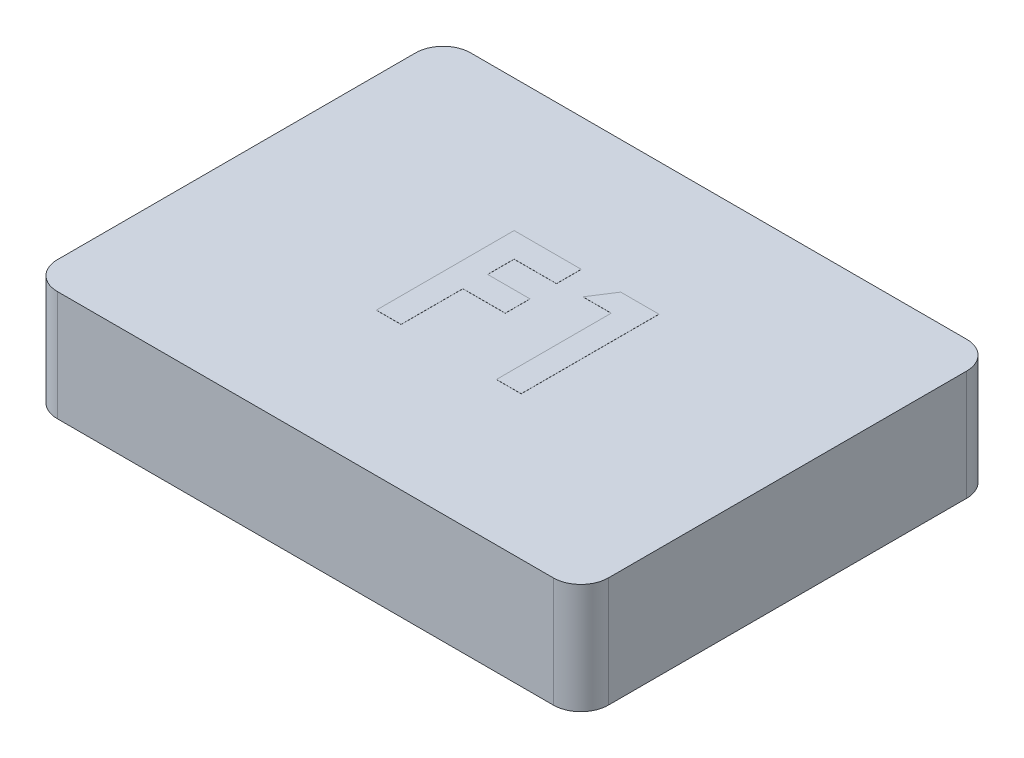
from build123d import *

# Parameters (mm, degrees)
SKETCH1_W           = 12.7
SKETCH1_H           = 9.525
BOSS_EXTRUDE1_DEPTH = 2.54
FILLET1_R           = 0.635
SHELL1_START        = 0.635
SHELL1_OUTLINE_W    = 1.905
SHELL1_OUTLINE_H    = 8.255
SHELL1_DEPTH        = 11.43
SKETCH2_R           = 2.54
BOSS_EXTRUDE2_DEPTH = 1.905
BOSS_EXTRUDE3_DEPTH = 0.00254


# Read off the part's stored shape, not the designer's step: Shell1
with BuildPart() as part:
    # Sketch1 → Boss-Extrude1 (new body)
    with BuildSketch(Plane(origin=(0, 0, 0), x_dir=(1, 0, 0), z_dir=(0, 1, 0))):
        with Locations((6.35, 4.7625)):
            Rectangle(SKETCH1_W, SKETCH1_H)
    extrude(amount=BOSS_EXTRUDE1_DEPTH)

    # Fillet1
    fillet1_edges = [part.edges().sort_by_distance(p)[0] for p in [
        (0, 1.27, -9.525),
        (12.7, 1.27, -9.525),
        (12.7, 1.27, 0),
        (0, 1.27, 0),
    ]]
    fillet(fillet1_edges, radius=FILLET1_R)

    # Shell1 outline → Shell1 (cut)
    with BuildSketch(Plane.YZ.offset(SHELL1_START)):
        with Locations((0.9525, -4.7625)):
            Rectangle(SHELL1_OUTLINE_W, SHELL1_OUTLINE_H)
    extrude(amount=SHELL1_DEPTH, mode=Mode.SUBTRACT)

    # Sketch2 → Boss-Extrude2 (add)
    with BuildSketch(Plane(origin=(0, 1.905, 0), x_dir=(-1, 0, 0), z_dir=(0, -1, 0))):
        with Locations(Location((-6.35, 4.7625, 0), (0, 0, 270))):
            Circle(SKETCH2_R)
    extrude(amount=BOSS_EXTRUDE2_DEPTH)

    # Sketch3 → Boss-Extrude3 (add)
    with BuildSketch(Plane(origin=(0, 2.54, 0), x_dir=(1, 0, 0), z_dir=(0, 1, 0))):
        Polygon((4.684346154, 6.477), (6.231141026, 6.477), (6.231141026, 5.907128205), (5.254217949, 5.907128205), (5.254217949, 5.296551282), (6.231141026, 5.296551282), (6.231141026, 4.726679487), (5.254217949, 4.726679487), (5.254217949, 3.302), (4.684346154, 3.302), align=None)
        Polygon((7.141282252, 6.477), (8.022166667, 6.477), (8.022166667, 3.302), (7.452294872, 3.302), (7.452294872, 5.947833333), (6.801012821, 5.947833333), align=None)
    extrude(amount=BOSS_EXTRUDE3_DEPTH)


solid = part.part
